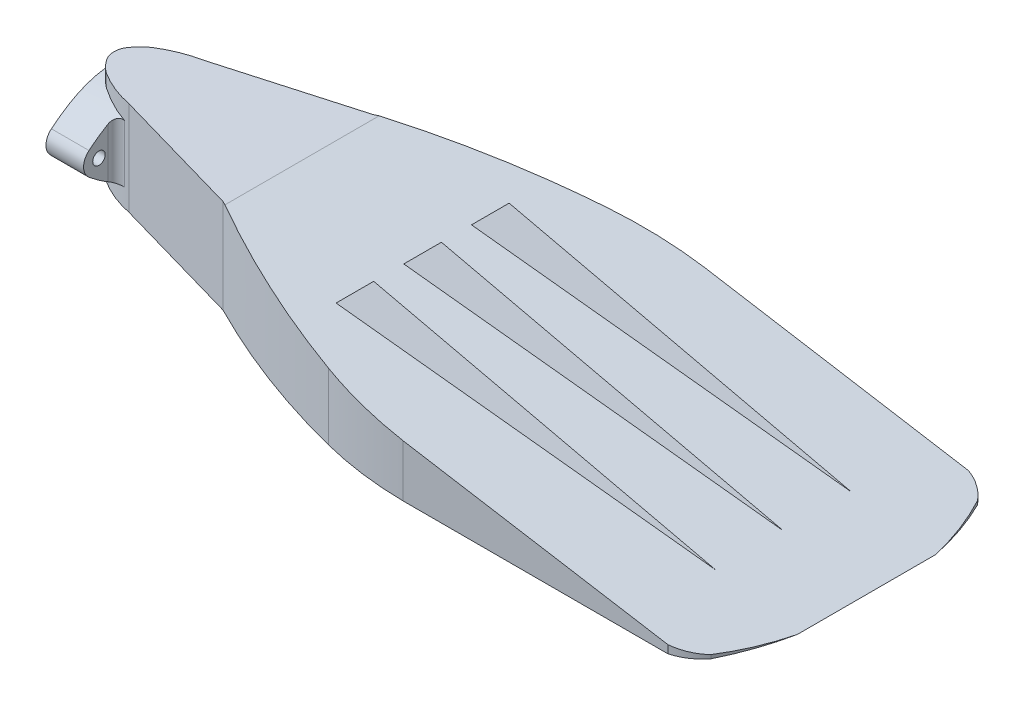
from build123d import *

# Parameters (mm, degrees)
SKETCH1_W               = 254
SKETCH1_H               = 31.75
BOSS_EXTRUDE1_DEPTH     = 50.8
CUT_EXTRUDE1_DEPTH      = 261.968776868
CUT_EXTRUDE1_DEPTH_BACK = 261.968776868
CUT_EXTRUDE2_DEPTH      = 261.968776868
CUT_EXTRUDE2_DEPTH_BACK = 101.6
CUT_EXTRUDE3_START      = -31.75
CUT_EXTRUDE3_DEPTH      = 31.75
CUT_EXTRUDE4_DEPTH      = 203.2
LPATTERN1_COUNT         = 2
LPATTERN1_PITCH         = 22.86
LPATTERN1_COL_COUNT     = 2
LPATTERN1_COL_PITCH     = 22.86
BOSS_EXTRUDE2_DEPTH     = 12.7
M5_TAPPED_HOLE1_D       = 4.2
M5_TAPPED_HOLE1_DEPTH   = 13.97
M5_TAPPED_HOLE1_TIP     = 1.2618073
FILLET1_R               = 2.54
FILLET2_R               = 5.08


# Read off the part's stored shape, not the designer's step: Cut-Extrude3
with BuildPart() as part:
    # Sketch1 → Boss-Extrude1 (new, symmetric)
    with BuildSketch(Plane.XY):
        with Locations((127, 15.875)):
            Rectangle(SKETCH1_W, SKETCH1_H)
    extrude(amount=BOSS_EXTRUDE1_DEPTH, both=True)

    # Sketch2 → Cut-Extrude1 (cut, two sides: drawn at the far end of the back side and taken through both)
    with BuildSketch(Plane.XY.offset(-CUT_EXTRUDE1_DEPTH_BACK)):
        Polygon((63.5, 31.75), (254, 0), (254, 31.75), align=None)
    extrude(amount=CUT_EXTRUDE1_DEPTH + CUT_EXTRUDE1_DEPTH_BACK, mode=Mode.SUBTRACT)

    # Sketch3 → Cut-Extrude2 (cut, two sides: drawn at the far end of the back side and taken through both)
    with BuildSketch(Plane(origin=(0, 0, 0), x_dir=(1, 0, 0), z_dir=(0, 1, 0)).offset(-CUT_EXTRUDE2_DEPTH_BACK)):
        with BuildLine():
            Line((17.78, 12.7), (17.78, 72.102848299))
            Line((17.78, 72.102848299), (-32.844059738, 72.102848299))
            Line((-32.844059738, 72.102848299), (-31.340021966, -58.533575325))
            Line((-31.340021966, -58.533575325), (17.78, -58.533575325))
            Line((17.78, -58.533575325), (17.78, -12.7))
            ThreePointArc((17.78, -12.7), (11.200161386, -10.734596536), (5.08, -7.62))
            ThreePointArc((5.08, -7.62), (3.005283766, -5.884716234), (1.27, -3.81))
            ThreePointArc((1.27, -3.81), (0.317306771, -2.010897743), (0, 0))
            ThreePointArc((0, 0), (0.317306771, 2.010897743), (1.27, 3.81))
            ThreePointArc((1.27, 3.81), (3.005283766, 5.884716234), (5.08, 7.62))
            ThreePointArc((5.08, 7.62), (11.200161386, 10.734596536), (17.78, 12.7))
        make_face()
    extrude(amount=CUT_EXTRUDE2_DEPTH + CUT_EXTRUDE2_DEPTH_BACK, mode=Mode.SUBTRACT)

    # Cut-Extrude3 outline → Cut-Extrude3 (cut)
    with BuildSketch(Plane(origin=(0, 31.75, 0), x_dir=(1, 0, 0), z_dir=(0, 1, 0)).offset(CUT_EXTRUDE3_START)):
        with BuildLine():
            Line((17.78, 12.7), (62.23, 25.4))
            ThreePointArc((62.23, 25.4), (90.202906045, 37.788778117), (119.38, 46.99))
            ThreePointArc((119.38, 46.99), (133.798896157, 49.763850575), (148.445575226, 50.8))
            Line((148.445575226, 50.8), (17.78, 50.8))
            Line((17.78, 50.8), (17.78, 12.7))
        make_face()
        with BuildLine():
            Line((255, 50.8), (237.800096312, 50.8))
            ThreePointArc((237.800096312, 50.8), (242.634955157, 48.613990909), (246.531625641, 45.012539127))
            ThreePointArc((246.531625641, 45.012539127), (250.977042308, 34.38284899), (254, 23.264676093))
            Line((254, 23.264676093), (255, 18.335620452))
            Line((255, 18.335620452), (255, 50.8))
        make_face()
    cut_extrude3 = extrude(amount=CUT_EXTRUDE3_DEPTH, mode=Mode.SUBTRACT)

    # Mirror2: Cut-Extrude3 across plane
    add(cut_extrude3.mirror(Plane.XY), mode=Mode.SUBTRACT)

    # Sketch7 → Cut-Extrude4 (cut)
    with BuildSketch(Plane(origin=(292.1, 0, 0), x_dir=(0, 0, -1), z_dir=(1, 0, 0))):
        Polygon((-6.35, 24.967833991), (6.35, 24.967833991), (0, 4.647833991), align=None)
    cut_extrude4 = extrude(amount=-CUT_EXTRUDE4_DEPTH, mode=Mode.SUBTRACT)

    # LPattern1: Cut-Extrude4 ×2
    with Locations(*[(0, 0, i * LPATTERN1_PITCH) for i in range(1, LPATTERN1_COUNT)]):
        add(cut_extrude4, mode=Mode.SUBTRACT)

    # LPattern1 col: Cut-Extrude4 ×2
    with Locations(*[(0, 0, -i * LPATTERN1_COL_PITCH) for i in range(1, LPATTERN1_COL_COUNT)]):
        add(cut_extrude4, mode=Mode.SUBTRACT)

    # Sketch9 → Boss-Extrude2 (add)
    with BuildSketch(Plane(origin=(0, 0, 0), x_dir=(0, 0, -1), z_dir=(1, 0, 0))):
        with BuildLine():
            add(Edge.make_bspline(
                [(-25.4, 15.875), (0, 41.275), (25.4, 15.875)],
                knots=[0, 0, 0, 1, 1, 1], degree=2))
            add(Edge.make_bspline(
                [(25.4, 15.875), (0, -9.525), (-25.4, 15.875)],
                knots=[0, 0, 0, 1, 1, 1], degree=2))
        make_face()
    extrude(amount=BOSS_EXTRUDE2_DEPTH)

    # M5 Tapped Hole1
    with Locations(Plane.ZY):
        with Locations((17.78, 15.875), (-17.78, 15.875)):
            Hole(M5_TAPPED_HOLE1_D / 2, depth=M5_TAPPED_HOLE1_DEPTH)
            with Locations((0, 0, -(M5_TAPPED_HOLE1_DEPTH + M5_TAPPED_HOLE1_TIP / 2))):  # 118° drill point
                Cone(0, M5_TAPPED_HOLE1_D / 2, M5_TAPPED_HOLE1_TIP, mode=Mode.SUBTRACT)

    # Fillet1
    fillet1_edges = [part.edges().sort_by_distance(p)[0] for p in [
        (12.7, 15.875, 11.298246193),
        (12.7, 15.875, -11.298246193),
    ]]
    fillet(fillet1_edges, radius=FILLET1_R)

    # Fillet2
    fillet2_edges = [part.edges().sort_by_distance(p)[0] for p in [
        (6.35, 15.875, -25.4),
        (6.35, 15.875, 25.4),
    ]]
    fillet(fillet2_edges, radius=FILLET2_R)


solid = part.part
